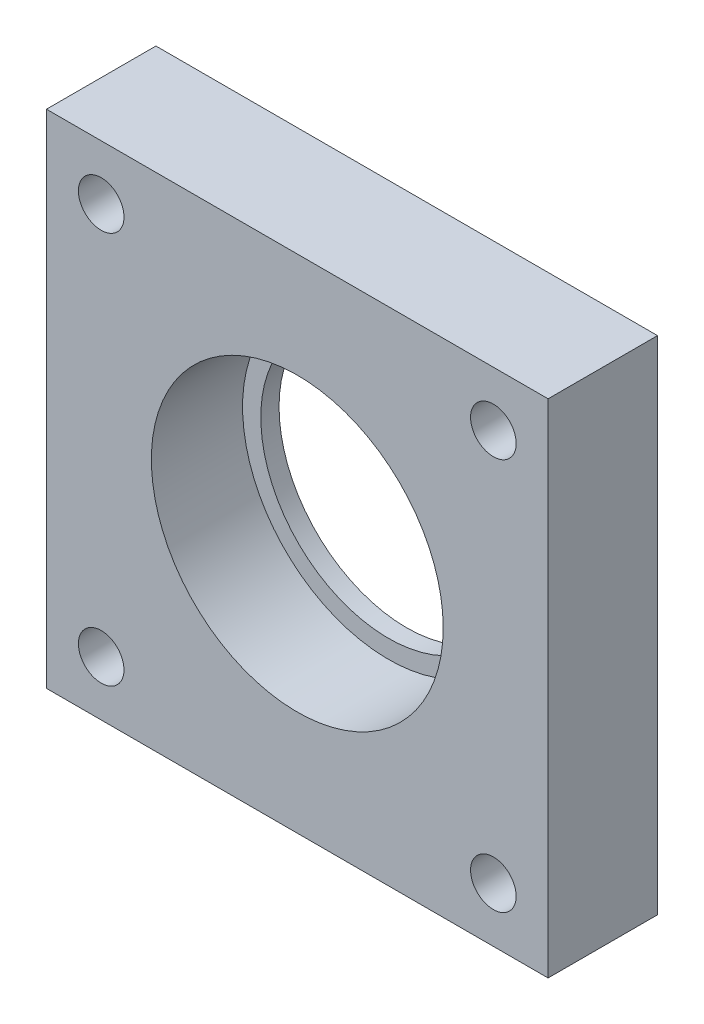
from build123d import *

# Parameters (mm, degrees)
SCHIZZO1_W                   = 55
SCHIZZO1_H                   = 55
ESTRUSIONE_ESTRUSIONE1_DEPTH = 12
SCHIZZO2_R                   = 16
TAGLIO_ESTRUSIONE1_DEPTH     = 10
SCHIZZO3_R                   = 14
TAGLIO_ESTRUSIONE2_DEPTH     = 10
SCHIZZO4_R                   = 2.5
TAGLIO_ESTRUSIONE3_DEPTH     = 12


with BuildPart() as part:
    # Schizzo1 → Estrusione-Estrusione1 (new body)
    with BuildSketch(Plane.XY):
        with Locations((27.5, 27.5)):
            Rectangle(SCHIZZO1_W, SCHIZZO1_H)
    extrude(amount=-ESTRUSIONE_ESTRUSIONE1_DEPTH)

    # Schizzo2 → Taglio-Estrusione1 (cut)
    with BuildSketch(Plane.XY):
        with Locations((27.5, 27.5)):
            Circle(SCHIZZO2_R)
    extrude(amount=-TAGLIO_ESTRUSIONE1_DEPTH, mode=Mode.SUBTRACT)

    # Schizzo3 → Taglio-Estrusione2 (cut)
    with BuildSketch(Plane.XY.offset(-10)):
        with Locations((27.5, 27.5)):
            Circle(SCHIZZO3_R)
    extrude(amount=-TAGLIO_ESTRUSIONE2_DEPTH, mode=Mode.SUBTRACT)

    # Schizzo4 → Taglio-Estrusione3 (cut)
    with BuildSketch(Plane.XY):
        with Locations((6, 49)):
            Circle(SCHIZZO4_R)
        with Locations((49, 49)):
            Circle(SCHIZZO4_R)
        with Locations((49, 6)):
            Circle(SCHIZZO4_R)
        with Locations((6, 6)):
            Circle(SCHIZZO4_R)
    extrude(amount=-TAGLIO_ESTRUSIONE3_DEPTH, mode=Mode.SUBTRACT)


solid = part.part
